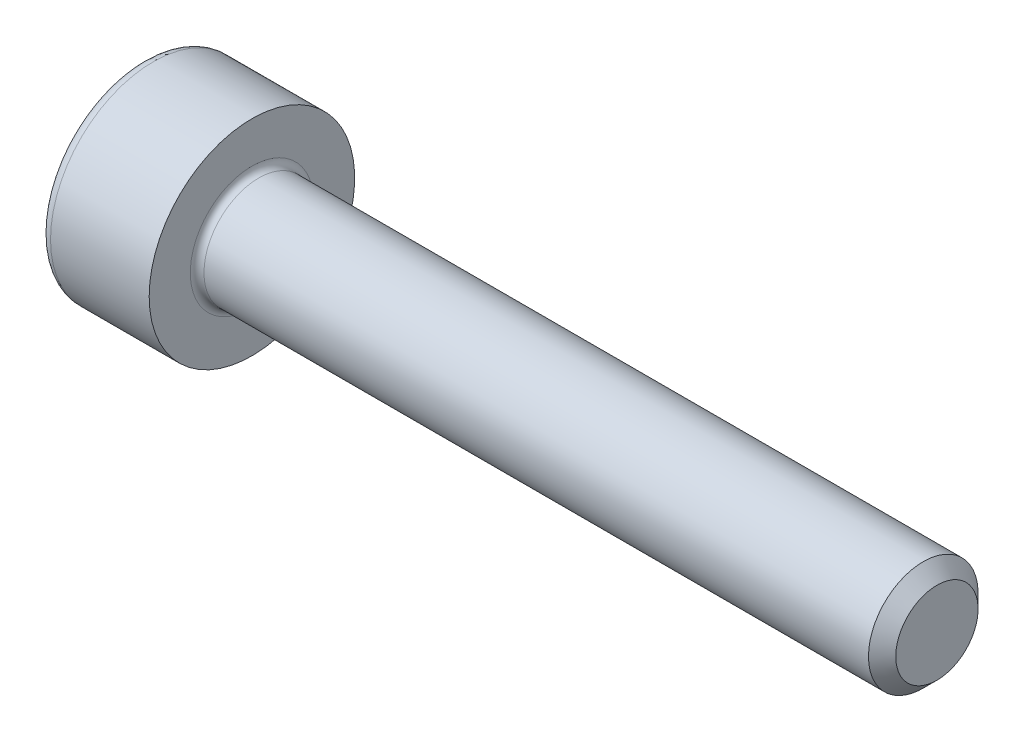
from build123d import *

# Parameters (mm, degrees)
FILLET1_R   = 0.1
FILLET2_R   = 0.16
HEX_2_DEPTH = 0.7


with BuildPart() as part:
    # BodySke → Base-Revolve (revolve)
    with BuildSketch(Plane.XY):
        Polygon((0, 0), (0, 1.5), (1.6, 1.5), (1.6, 0.8), (11.401, 0.8), (11.6, 0.601), (11.6, 0), align=None)
    revolve(axis=Axis((-31.75, 0, 0), (1, 0, 0)))

    # Fillet1
    fillet1_edges = [part.edges().sort_by_distance(p)[0] for p in [
        (1.6, -0.8, 0),
    ]]
    fillet(fillet1_edges, radius=FILLET1_R)

    # Fillet2
    fillet2_edges = [part.edges().sort_by_distance(p)[0] for p in [
        (0, -1.5, 0),
    ]]
    fillet(fillet2_edges, radius=FILLET2_R)

    # Sketch2 → Hex-PreBroach (revolve, cut)
    with BuildSketch(Plane.XY):
        Polygon((0, 0.76), (0.7, 0.76), (1.138786205, 0), (0, 0), align=None)
    revolve(axis=Axis((0, 0, 0), (1, 0, 0)), mode=Mode.SUBTRACT)

    # Sketch3 → Hex 2 (cut)
    with BuildSketch(Plane(origin=(0, 0, 0), x_dir=(0, 0.500000000000001, 0.866025403784438), z_dir=(-1, 0, 0))):
        Polygon((0.438786205, 0.76), (-0.438786205, 0.76), (-0.877572409, 0), (-0.438786205, -0.76), (0.438786205, -0.76), (0.877572409, 0), align=None)
    extrude(amount=-HEX_2_DEPTH, mode=Mode.SUBTRACT)


solid = part.part
